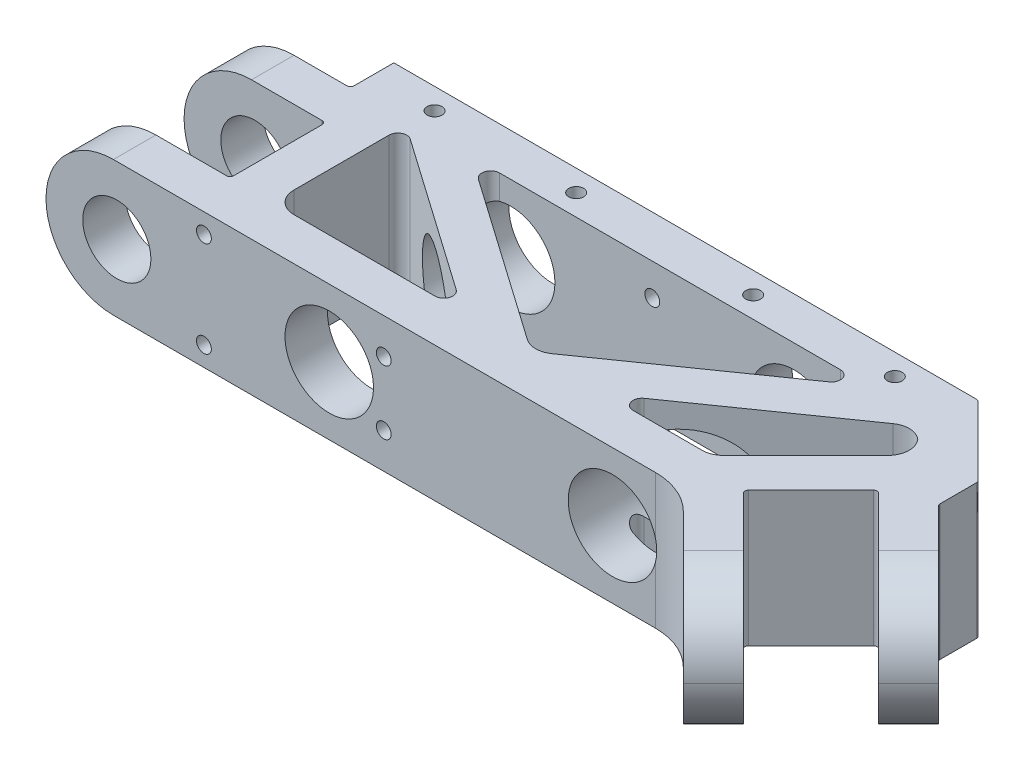
from build123d import *

# Parameters (mm, degrees)
BOSS_EXTRUDE1_DEPTH         = 19.05
SKETCH2_R                   = 9.625
CUT_EXTRUDE1_DEPTH          = 230.702993015
SKETCH3_R                   = 9.625
CUT_EXTRUDE2_DEPTH          = 160.257897721
FILLET1_R                   = 19.05
FILLET3_R                   = 19.05
CHAMFER1_SIZE               = 20
FILLET4_R                   = 1
TAP_DRILL_FOR_TAP2_D        = 4.2
TAP_DRILL_FOR_TAP2_DEPTH    = 15
TAP_DRILL_FOR_TAP2_TIP      = 1.2618073
TAP_DRILL_FOR_TAP3_D        = 4.2
TAP_DRILL_FOR_TAP3_DEPTH    = 15
TAP_DRILL_FOR_TAP3_TIP      = 1.2618073
CUT_EXTRUDE10_DEPTH         = 260.46369054
FILLET9_R                   = 2.5
FILLET11_R                  = 6
FILLET12_R                  = 2.5
TAP_DRILL_FOR_M5X0_8_TAP1_D = 4.2
SKETCH23_R                  = 12.5
CUT_EXTRUDE11_DEPTH         = 240.191986375


# Some blends are built 0.0001 mm under size
with BuildPart() as part:
    # Sketch1 → Boss-Extrude1 (new, symmetric)
    with BuildSketch(Plane(origin=(0, 0, 0), x_dir=(1, 0, 0), z_dir=(0, 1, 0))):
        Polygon((-185, -40.25), (-185, -52.5), (-220, -52.5), (-220, -64.5), (-180, -64.5), (-180, -91.5), (-220, -91.5), (-220, -103.5), (-39.987067043, -103.5), (-11.313708499, -132.173358544), (-2.828427125, -123.68807717), (-31.112698372, -95.403805922), (-12.02081528, -76.31192283), (16.263455967, -104.596194078), (24.748737342, -96.110912703), (0, -71.362175362), (0, -40.25), align=None)
    extrude(amount=BOSS_EXTRUDE1_DEPTH, both=True)

    # Sketch2 → Cut-Extrude1 (cut, through all)
    with BuildSketch(Plane.XY.offset(103.5)):
        with Locations((-200, 0)):
            Circle(SKETCH2_R)
    extrude(amount=-CUT_EXTRUDE1_DEPTH, mode=Mode.SUBTRACT)

    # Sketch3 → Cut-Extrude2 (cut, through all)
    with BuildSketch(Plane(origin=(-103.622699206, 0, 39.864367837), x_dir=(-0.7071067811865479, 0, -0.7071067811865472), z_dir=(0.7071067811865472, 0, -0.7071067811865479))):
        with Locations(Location((-110.544626587, 0, 0), (0, 0, 180))):
            Circle(SKETCH3_R)
    extrude(amount=CUT_EXTRUDE2_DEPTH, mode=Mode.SUBTRACT)

    # Fillet1
    fillet1_edges = [part.edges().sort_by_distance(p)[0] for p in [
        (-220, -19.05, 58.5),
        (-220, 19.05, 58.5),
        (-220, 19.05, 97.5),
        (-220, -19.05, 97.5),
        (20.506096654, -19.05, 100.353553391),
        (20.506096654, 19.05, 100.353553391),
        (-7.071067812, 19.05, 127.930717857),
        (-7.071067812, -19.05, 127.930717857),
    ]]
    fillet(fillet1_edges, radius=FILLET1_R - 0.0001)  # a hair under: the kernel refuses the full size

    # Fillet3
    fillet3_edges = [part.edges().sort_by_distance(p)[0] for p in [
        (-39.987067043, 0, 103.5),
    ]]
    fillet(fillet3_edges, radius=FILLET3_R)

    # Chamfer1
    chamfer1_edges = [part.edges().sort_by_distance(p)[0] for p in [
        (0, 0, 40.25),
    ]]
    chamfer(chamfer1_edges, length=CHAMFER1_SIZE)

    # Fillet4
    fillet4_edges = [part.edges().sort_by_distance(p)[0] for p in [
        (-20, 0, 40.25),
        (0, 0, 60.25),
        (0, 0, 71.362175362),
        (-12.02081528, 0, 76.31192283),
        (-31.112698372, 0, 95.403805922),
        (-180, 0, 91.5),
        (-180, 0, 64.5),
        (-185, 0, 52.5),
    ]]
    fillet(fillet4_edges, radius=FILLET4_R)

    # Tap Drill for  Tap2
    with Locations(Plane(origin=(0, 0, 40.25), x_dir=(-1, 0, 0), z_dir=(0, 0, -1))):
        with Locations((25, 10.05), (100, 10.05), (175, 10.05), (175, -10.05), (100, -10.05), (25, -10.05)):
            Hole(TAP_DRILL_FOR_TAP2_D / 2, depth=TAP_DRILL_FOR_TAP2_DEPTH)
            with Locations((0, 0, -(TAP_DRILL_FOR_TAP2_DEPTH + TAP_DRILL_FOR_TAP2_TIP / 2))):  # 118° drill point
                Cone(0, TAP_DRILL_FOR_TAP2_D / 2, TAP_DRILL_FOR_TAP2_TIP, mode=Mode.SUBTRACT)

    # Tap Drill for  Tap3
    with Locations(Plane.XY.offset(103.5)):
        with Locations((-175.4, 13.5), (-175.4, -13.5), (-124.6, -9), (-124.6, 9)):
            Hole(TAP_DRILL_FOR_TAP3_D / 2, depth=TAP_DRILL_FOR_TAP3_DEPTH)
            with Locations((0, 0, -(TAP_DRILL_FOR_TAP3_DEPTH + TAP_DRILL_FOR_TAP3_TIP / 2))):  # 118° drill point
                Cone(0, TAP_DRILL_FOR_TAP3_D / 2, TAP_DRILL_FOR_TAP3_TIP, mode=Mode.SUBTRACT)

    # Sketch19 → Cut-Extrude10 (cut, through all)
    with BuildSketch(Plane.XZ.offset(19.05)):
        Polygon((-114.177914752, 91.5), (-168, 91.5), (-168, 53.813370187), align=None)
        Polygon((-38.945190735, 52.25), (-95, 91.5), (-151.054809265, 52.25), align=None)
        Polygon((-44.179455198, 91.5), (-74.078638453, 91.5), (-22.109644245, 55.110918503), (-14.950008973, 62.270553775), align=None)
    extrude(amount=-CUT_EXTRUDE10_DEPTH, mode=Mode.SUBTRACT)

    # Fillet9
    fillet9_edges = [part.edges().sort_by_distance(p)[0] for p in [
        (-38.945190735, 0, 52.25),
        (-151.054809265, 0, 52.25),
    ]]
    fillet(fillet9_edges, radius=FILLET9_R)

    # Fillet11
    # the kernel refuses this fillet: 6 mm, written as the material it adds along each edge
    with BuildSketch(Plane(origin=(-168, -19.05, 91.5), x_dir=(0, 0, -1), z_dir=(0, 1, 0)), Plane(origin=(-14.950008973, -19.05, 62.270553775), x_dir=(-0.707106781186547, 0, 0.7071067811865482), z_dir=(0, 1, 0))) as fillet11_piece_1:
        with BuildLine():
            CenterArc((FILLET11_R, -FILLET11_R), FILLET11_R, 90, 90)
            Line((0, -FILLET11_R), (0, 0))
            Line((0, 0), (FILLET11_R, 0))
        make_face()
    extrude(amount=38.1)
    with BuildSketch(Plane(origin=(-95, -19.05, 91.5), x_dir=(-0.8191520442889937, 0, -0.5735764363510434), z_dir=(0, 1, 0))) as fillet11_piece_2:
        with BuildLine():
            CenterArc((FILLET11_R * 0.70020753821, -FILLET11_R), FILLET11_R, 90, 70)
            Line((-FILLET11_R * 0.239485082576, -FILLET11_R * 0.657979856674), (0, 0))
            Line((0, 0), (FILLET11_R * 0.70020753821, 0))
        make_face()
    extrude(amount=38.1)
    with BuildSketch(Plane(origin=(-22.109644245, -19.05, 55.110918503), x_dir=(0.7071067811865479, 0, 0.7071067811865472), z_dir=(0, 1, 0))) as fillet11_piece_3:
        with BuildLine():
            CenterArc((FILLET11_R * 0.839099631177, -FILLET11_R), FILLET11_R, 90, 80)
            Line((-FILLET11_R * 0.145708121835, -FILLET11_R * 0.826351822333), (0, 0))
            Line((0, 0), (FILLET11_R * 0.839099631177, 0))
        make_face()
    extrude(amount=38.1)
    with BuildSketch(Plane(origin=(-44.179455198, -19.05, 91.5), x_dir=(0.7071067811865461, 0, -0.7071067811865489), z_dir=(0, 1, 0))) as fillet11_piece_4:
        with BuildLine():
            CenterArc((FILLET11_R * 0.414213562373, FILLET11_R), FILLET11_R, 225, 45)
            Line((-FILLET11_R * 0.292893218813, FILLET11_R * 0.292893218813), (0, 0))
            Line((0, 0), (FILLET11_R * 0.414213562373, 0))
        make_face()
    extrude(amount=38.1)

    # Fillet12
    fillet12_edges = [part.edges().sort_by_distance(p)[0] for p in [
        (-114.177914752, 0, 91.5),
        (-168, 0, 53.813370187),
        (-74.078638453, 0, 91.5),
    ]]
    fillet(fillet12_edges, radius=FILLET12_R)

    # Tap Drill for M5x0.8 Tap1 (through all)
    with Locations(Plane(origin=(0, 19.05, 0), x_dir=(1, 0, 0), z_dir=(0, 1, 0))):
        with Locations((-37.5, -46.25), (-77.5, -46.25), (-127.5, -46.25), (-167.5, -46.25)):
            Hole(TAP_DRILL_FOR_M5X0_8_TAP1_D / 2)

    # Sketch23 → Cut-Extrude11 (cut, through all)
    with BuildSketch(Plane.XY.offset(40.25)):
        with Locations(Location((-140, 0, 0), (0, 0, 180))):
            Circle(SKETCH23_R)
        with Locations(Location((-60, 0, 0), (0, 0, 345.876770751))):
            Circle(SKETCH23_R)
    extrude(amount=CUT_EXTRUDE11_DEPTH, mode=Mode.SUBTRACT)


solid = part.part
